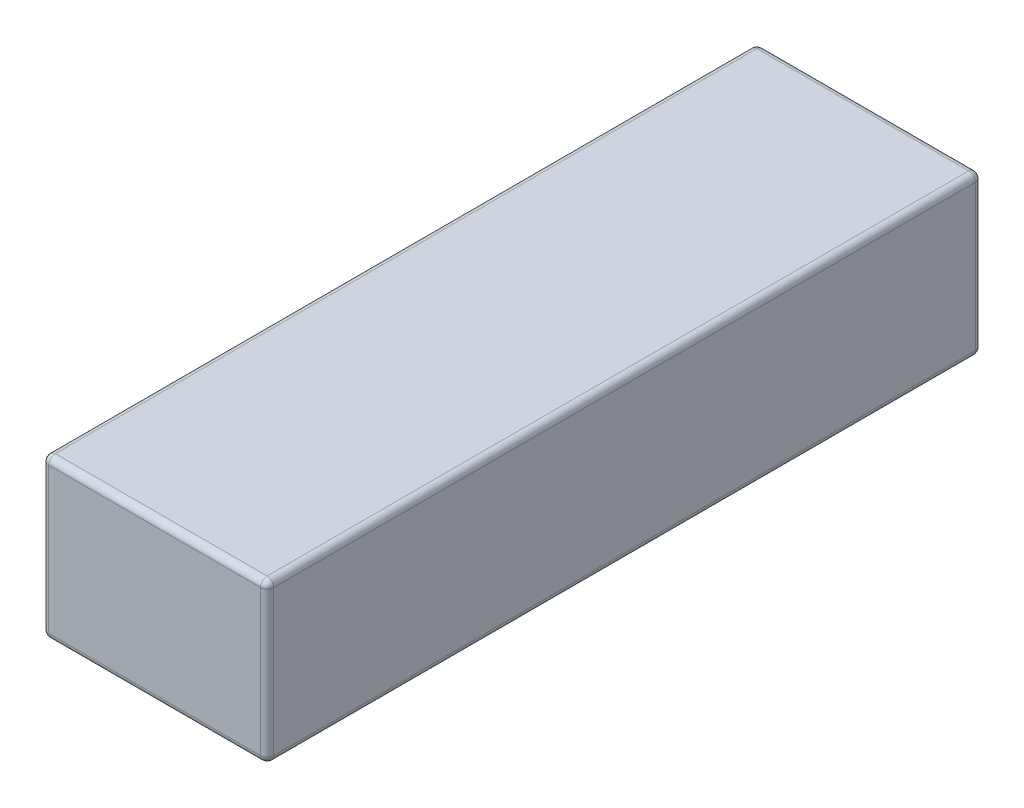
from build123d import *

# Parameters (mm, degrees)
SKETCH1_W           = 34
SKETCH1_H           = 24
BOSS_EXTRUDE1_DEPTH = 108
FILLET1_R           = 1


with BuildPart() as part:
    # Sketch1 → Boss-Extrude1 (new body)
    with BuildSketch(Plane.XY):
        Rectangle(SKETCH1_W, SKETCH1_H)
    extrude(amount=BOSS_EXTRUDE1_DEPTH)

    # Fillet1
    fillet1_edges = [part.edges().sort_by_distance(p)[0] for p in [
        (0, 12, 0),
        (0, 12, 108),
        (-17, 12, 54),
        (-17, 0, 108),
        (-17, 0, 0),
        (-17, -12, 54),
        (0, -12, 108),
        (0, -12, 0),
        (17, -12, 54),
        (17, 0, 108),
        (17, 12, 54),
        (17, 0, 0),
    ]]
    fillet(fillet1_edges, radius=FILLET1_R)


solid = part.part
